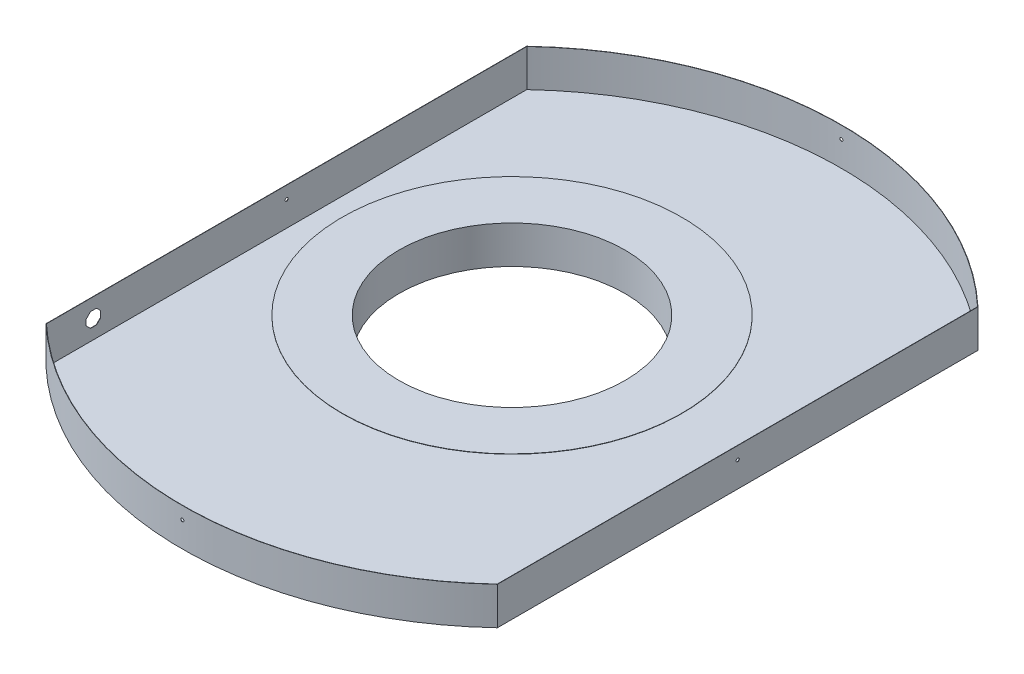
from build123d import *

# Parameters (mm, degrees)
SKETCH1_R                = 1750
BOSS_EXTRUDE1_DEPTH      = 500
SKETCH2_R                = 900
CUT_EXTRUDE2_DEPTH       = 300
CUT_EXTRUDE10_DEPTH      = 2525.876234591
CUT_EXTRUDE10_DEPTH_BACK = 2525.876234591
SKETCH10_W               = 4401.17604026
SKETCH10_H               = 5623.086471134
SKETCH10_W_2             = 2396.119838962
SKETCH10_H_2             = 4339.917258658
SKETCH3_R                = 600
CUT_EXTRUDE3_DEPTH       = 300
SHELL1_T                 = -1.5
SKETCH11_W               = 3093.35758239
SKETCH11_H               = 4860.990486612
CUT_EXTRUDE11_DEPTH      = 2142.92613567
SKETCH7_R                = 8.382
CUT_EXTRUDE6_DEPTH       = 900
CIRPATTERN1_COUNT        = 4
CUT_EXTRUDE13_DEPTH      = 10


with BuildPart() as part:
    # Sketch1 → Boss-Extrude1 (new body)
    with BuildSketch(Plane(origin=(0, 0, 0), x_dir=(1, 0, 0), z_dir=(0, 1, 0))):
        Circle(SKETCH1_R)
    extrude(amount=BOSS_EXTRUDE1_DEPTH)

    # Sketch2 → Cut-Extrude2 (cut)
    with BuildSketch(Plane(origin=(0, 500, 0), x_dir=(1, 0, 0), z_dir=(0, 1, 0))):
        Circle(SKETCH2_R)
    extrude(amount=-CUT_EXTRUDE2_DEPTH, mode=Mode.SUBTRACT)

    # Sketch10 → Cut-Extrude10 (cut, two sides: drawn at the far end of the back side and taken through both)
    with BuildSketch(Plane(origin=(0, 500, 0), x_dir=(1, 0, 0), z_dir=(0, 1, 0)).offset(-CUT_EXTRUDE10_DEPTH_BACK)):
        Rectangle(SKETCH10_W, SKETCH10_H)
        Rectangle(SKETCH10_W_2, SKETCH10_H_2, mode=Mode.SUBTRACT)
    extrude(amount=CUT_EXTRUDE10_DEPTH + CUT_EXTRUDE10_DEPTH_BACK, mode=Mode.SUBTRACT)

    # Sketch3 → Cut-Extrude3 (cut)
    with BuildSketch(Plane.XZ):
        Circle(SKETCH3_R)
    extrude(amount=-CUT_EXTRUDE3_DEPTH, mode=Mode.SUBTRACT)

    # Shell1
    shell1_openings = [part.faces().sort_by_distance(p)[0] for p in [
        (1155.643660473, 500, 0),
    ]]
    offset(amount=SHELL1_T, openings=shell1_openings, kind=Kind.INTERSECTION)

    # Sketch11 → Cut-Extrude11 (cut, through all)
    with BuildSketch(Plane(origin=(0, 200, 0), x_dir=(1, 0, 0), z_dir=(0, 1, 0))):
        Rectangle(SKETCH11_W, SKETCH11_H)
    extrude(amount=CUT_EXTRUDE11_DEPTH, mode=Mode.SUBTRACT)

    # Sketch7 → Cut-Extrude6 (cut)
    with BuildSketch(Plane.XY.offset(2000)):
        with Locations((0, 133.897639423)):
            Circle(SKETCH7_R)
    cut_extrude6 = extrude(amount=-CUT_EXTRUDE6_DEPTH, mode=Mode.SUBTRACT)

    # CirPattern1: Cut-Extrude6 ×4 about axis
    cirpattern1_axis = Axis((0, 500, 0), (0, -1, 0))
    for i in range(1, CIRPATTERN1_COUNT):
        add(cut_extrude6.rotate(cirpattern1_axis, i * 360 / CIRPATTERN1_COUNT), mode=Mode.SUBTRACT)

    # Sketch12 → Cut-Extrude13 (cut)
    with BuildSketch(Plane.ZY.offset(1198.059919481)):
        Polygon((986.482270432, 84.275662181), (1009.035048281, 61.722884332), (1040.929492584, 61.722884332), (1063.482270432, 84.275662181), (1063.482270432, 116.170106484), (1040.929492584, 138.722884332), (1009.035048281, 138.722884332), (986.482270432, 116.170106484), align=None)
    extrude(amount=-CUT_EXTRUDE13_DEPTH, mode=Mode.SUBTRACT)


solid = part.part
